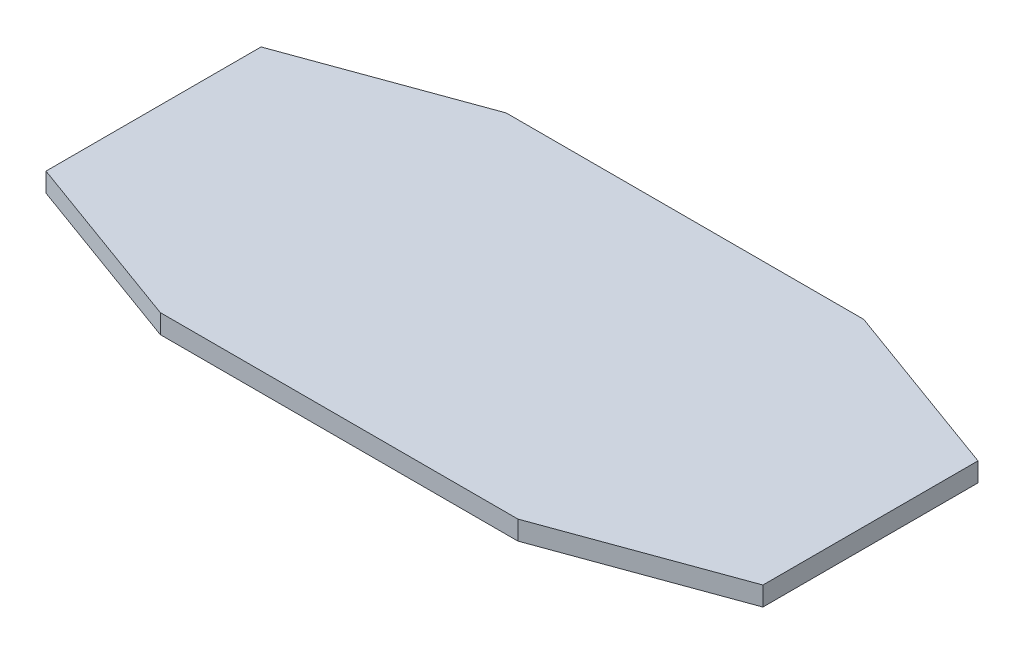
from build123d import *

# Parameters (mm, degrees)
BOSS_EXTRUDE1_DEPTH = 8


with BuildPart() as part:
    # Sketch1 → Boss-Extrude1 (new body)
    with BuildSketch(Plane(origin=(0, 0, 0), x_dir=(1, 0, 0), z_dir=(0, 1, 0))):
        Polygon((-150, 45), (-150, -45), (-74.824590337, -72.361611466), (74.824590337, -72.361611466), (150, -45), (150, 45), (74.824590337, 72.361611466), (-74.824590337, 72.361611466), align=None)
    extrude(amount=BOSS_EXTRUDE1_DEPTH)


solid = part.part
